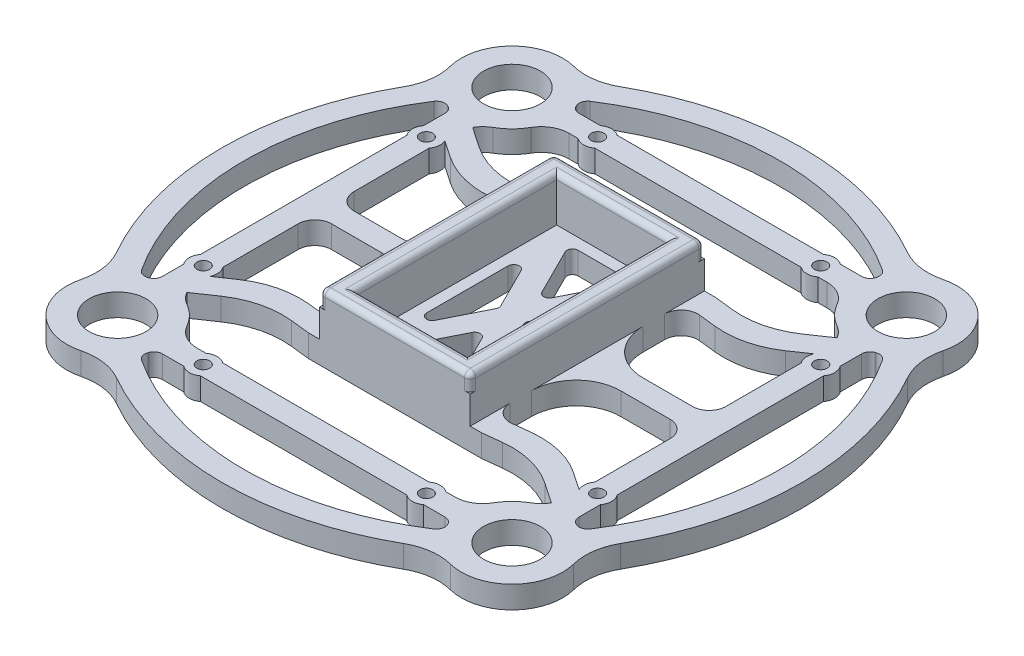
from build123d import *

# Parameters (mm, degrees)
SKETCH1_R           = 5.1
BOSS_EXTRUDE1_DEPTH = 4
BOSS_EXTRUDE2_START = -4
BOSS_EXTRUDE2_DEPTH = 4
SKETCH3_R           = 2.5
BOSS_EXTRUDE3_DEPTH = 4
SKETCH4_R           = 1.15
CUT_EXTRUDE1_DEPTH  = 4
FILLET1_R           = 10
FILLET2_R           = 1.5
FILLET3_R           = 5
BOSS_EXTRUDE4_START = -4
SKETCH5_W           = 31
SKETCH5_H           = 42
SKETCH5_W_2         = 17.855339059
SKETCH5_H_2         = 3
BOSS_EXTRUDE4_DEPTH = 4
SKETCH6_W           = 27
SKETCH6_H           = 42
SKETCH6_W_2         = 20
SKETCH6_H_2         = 36
BOSS_EXTRUDE5_DEPTH = 8
CUT_EXTRUDE4_DEPTH  = 74.972968176
FILLET4_R           = 15
FILLET5_R           = 8
FILLET6_R           = 3
FILLET9_START       = 9
FILLET9_DEPTH       = 4
FILLET10_START      = 9
FILLET10_DEPTH      = 4
FILLET11_START      = 9
FILLET11_DEPTH      = 4
FILLET12_START      = 9
FILLET12_DEPTH      = 4
FILLET13_R          = 1
CUT_EXTRUDE5_DEPTH  = 74.972968176
FILLET14_R          = 1
SKETCH10_R          = 1.5
CUT_EXTRUDE6_DEPTH  = 3


with BuildPart() as part:
    # Sketch1 → Boss-Extrude1 (new body)
    with BuildSketch(Plane(origin=(0, 0, 0), x_dir=(1, 0, 0), z_dir=(0, 1, 0))):
        with BuildLine():
            ThreePointArc((-42.589636172, 29.834927363), (-52, 0), (-42.589636172, -29.834927363))
            ThreePointArc((-42.589636172, -29.834927363), (-41.790010768, -41.790010768), (-29.834927363, -42.589636172))
            ThreePointArc((-29.834927363, -42.589636172), (0, -52), (29.834927363, -42.589636172))
            ThreePointArc((29.834927363, -42.589636172), (41.790010768, -41.790010768), (42.589636172, -29.834927363))
            ThreePointArc((42.589636172, -29.834927363), (52, 0), (42.589636172, 29.834927363))
            ThreePointArc((42.589636172, 29.834927363), (41.790010768, 41.790010768), (29.834927363, 42.589636172))
            ThreePointArc((29.834927363, 42.589636172), (0, 52), (-29.834927363, 42.589636172))
            ThreePointArc((-29.834927363, 42.589636172), (-41.790010768, 41.790010768), (-42.589636172, 29.834927363))
        make_face()
        with Locations(Location((-35.355339059, -35.355339059, 0), (0, 0, 270))):
            Circle(SKETCH1_R, mode=Mode.SUBTRACT)
        with Locations(Location((35.355339059, -35.355339059, 0), (0, 0, 270))):
            Circle(SKETCH1_R, mode=Mode.SUBTRACT)
        with BuildLine():
            ThreePointArc((-27.258640426, -39.509068859), (-28.920667351, -28.920667351), (-39.509068859, -27.258640426))
            ThreePointArc((-39.509068859, -27.258640426), (-48, 0), (-39.509068859, 27.258640426))
            ThreePointArc((-39.509068859, 27.258640426), (-28.920667351, 28.920667351), (-27.258640426, 39.509068859))
            ThreePointArc((-27.258640426, 39.509068859), (0, 48), (27.258640426, 39.509068859))
            ThreePointArc((27.258640426, 39.509068859), (28.920667351, 28.920667351), (39.509068859, 27.258640426))
            ThreePointArc((39.509068859, 27.258640426), (48, 0), (39.509068859, -27.258640426))
            ThreePointArc((39.509068859, -27.258640426), (28.920667351, -28.920667351), (27.258640426, -39.509068859))
            ThreePointArc((27.258640426, -39.509068859), (0, -48), (-27.258640426, -39.509068859))
        make_face(mode=Mode.SUBTRACT)
        with Locations(Location((-35.355339059, 35.355339059, 0), (0, 0, 270))):
            Circle(SKETCH1_R, mode=Mode.SUBTRACT)
        with Locations(Location((35.355339059, 35.355339059, 0), (0, 0, 270))):
            Circle(SKETCH1_R, mode=Mode.SUBTRACT)
    extrude(amount=BOSS_EXTRUDE1_DEPTH)

    # Sketch2 → Boss-Extrude2 (add)
    with BuildSketch(Plane(origin=(0, 4, 0), x_dir=(1, 0, 0), z_dir=(0, 1, 0)).offset(BOSS_EXTRUDE2_START)):
        with BuildLine():
            ThreePointArc((-26.255339059, 35.355339059), (-26.311135203, 34.349169788), (-26.477839411, 33.355339059))
            Line((-26.477839411, 33.355339059), (26.477839411, 33.355339059))
            ThreePointArc((26.477839411, 33.355339059), (26.255339059, 35.355339059), (26.477839411, 37.355339059))
            Line((26.477839411, 37.355339059), (-26.477839411, 37.355339059))
            ThreePointArc((-26.477839411, 37.355339059), (-26.311135203, 36.36150833), (-26.255339059, 35.355339059))
        make_face()
        with BuildLine():
            Line((-33.355339059, -26.477839411), (-33.355339059, 26.477839411))
            ThreePointArc((-33.355339059, 26.477839411), (-35.355339059, 26.255339059), (-37.355339059, 26.477839411))
            Line((-37.355339059, 26.477839411), (-37.355339059, -26.477839411))
            ThreePointArc((-37.355339059, -26.477839411), (-35.355339059, -26.255339059), (-33.355339059, -26.477839411))
        make_face()
        with BuildLine():
            ThreePointArc((37.355339059, 26.477839411), (35.355339059, 26.255339059), (33.355339059, 26.477839411))
            Line((33.355339059, 26.477839411), (33.355339059, -26.477839411))
            ThreePointArc((33.355339059, -26.477839411), (35.355339059, -26.255339059), (37.355339059, -26.477839411))
            Line((37.355339059, -26.477839411), (37.355339059, 26.477839411))
        make_face()
        with BuildLine():
            Line((26.477839411, -33.355339059), (-26.477839411, -33.355339059))
            ThreePointArc((-26.477839411, -33.355339059), (-26.311135203, -34.349169788), (-26.255339059, -35.355339059))
            ThreePointArc((-26.255339059, -35.355339059), (-26.311135203, -36.36150833), (-26.477839411, -37.355339059))
            Line((-26.477839411, -37.355339059), (26.477839411, -37.355339059))
            ThreePointArc((26.477839411, -37.355339059), (26.255339059, -35.355339059), (26.477839411, -33.355339059))
        make_face()
    extrude(amount=BOSS_EXTRUDE2_DEPTH)

    # Sketch3 → Boss-Extrude3 (add)
    with BuildSketch(Plane(origin=(0, 4, 0), x_dir=(1, 0, 0), z_dir=(0, 1, 0))):
        with Locations((-20, 35.355339059)):
            Circle(SKETCH3_R)
        with Locations((20, 35.355339059)):
            Circle(SKETCH3_R)
        with Locations((35.355339059, 20)):
            Circle(SKETCH3_R)
        with Locations((35.355339059, -20)):
            Circle(SKETCH3_R)
        with Locations((-35.355339059, -20)):
            Circle(SKETCH3_R)
        with Locations((-35.355339059, 20)):
            Circle(SKETCH3_R)
        with Locations((-20, -35.355339059)):
            Circle(SKETCH3_R)
        with Locations((20, -35.355339059)):
            Circle(SKETCH3_R)
    extrude(amount=-BOSS_EXTRUDE3_DEPTH)

    # Sketch4 → Cut-Extrude1 (cut)
    with BuildSketch(Plane(origin=(0, 4, 0), x_dir=(1, 0, 0), z_dir=(0, 1, 0))):
        with Locations(Location((-20, 35.355339059, 0), (0, 0, 270))):
            Circle(SKETCH4_R)
        with Locations(Location((20, 35.355339059, 0), (0, 0, 270))):
            Circle(SKETCH4_R)
        with Locations(Location((-35.355339059, 20, 0), (0, 0, 270))):
            Circle(SKETCH4_R)
        with Locations(Location((-35.355339059, -20, 0), (0, 0, 270))):
            Circle(SKETCH4_R)
        with Locations(Location((-20, -35.355339059, 0), (0, 0, 270))):
            Circle(SKETCH4_R)
        with Locations(Location((20, -35.355339059, 0), (0, 0, 270))):
            Circle(SKETCH4_R)
        with Locations(Location((35.355339059, -20, 0), (0, 0, 270))):
            Circle(SKETCH4_R)
        with Locations(Location((35.355339059, 20, 0), (0, 0, 270))):
            Circle(SKETCH4_R)
    extrude(amount=-CUT_EXTRUDE1_DEPTH, mode=Mode.SUBTRACT)

    # Fillet1
    fillet1_edges = [part.edges().sort_by_distance(p)[0] for p in [
        (-42.589636172, 2, 29.834927363),
        (-42.589636172, 2, -29.834927363),
        (-29.834927363, 2, -42.589636172),
        (29.834927363, 2, -42.589636172),
        (42.589636172, 2, -29.834927363),
        (42.589636172, 2, 29.834927363),
        (29.834927363, 2, 42.589636172),
        (-29.834927363, 2, 42.589636172),
    ]]
    fillet(fillet1_edges, radius=FILLET1_R)

    # Fillet2
    fillet2_edges = [part.edges().sort_by_distance(p)[0] for p in [
        (37.355339059, 2, -26.477839411),
        (37.355339059, 2, 26.477839411),
        (-26.477839411, 2, 37.355339059),
        (26.477839411, 2, 37.355339059),
        (27.258640426, 2, 39.509068859),
        (39.509068859, 2, 27.258640426),
        (39.509068859, 2, -27.258640426),
        (27.258640426, 2, -39.509068859),
        (-27.258640426, 2, -39.509068859),
        (-39.509068859, 2, -27.258640426),
        (-39.509068859, 2, 27.258640426),
        (-27.258640426, 2, 39.509068859),
        (-26.477839411, 2, -37.355339059),
        (26.477839411, 2, -37.355339059),
        (-37.355339059, 2, -26.477839411),
        (-37.355339059, 2, 26.477839411),
    ]]
    fillet(fillet2_edges, radius=FILLET2_R)

    # Fillet3
    fillet3_edges = [part.edges().sort_by_distance(p)[0] for p in [
        (33.355339059, 2, -26.477839411),
        (33.355339059, 2, 26.477839411),
        (-26.477839411, 2, 33.355339059),
        (26.477839411, 2, 33.355339059),
        (-26.477839411, 2, -33.355339059),
        (26.477839411, 2, -33.355339059),
        (-33.355339059, 2, -26.477839411),
        (-33.355339059, 2, 26.477839411),
    ]]
    fillet(fillet3_edges, radius=FILLET3_R)

    # Sketch5 → Boss-Extrude4 (add)
    with BuildSketch(Plane.XZ.offset(BOSS_EXTRUDE4_START)):
        with BuildLine():
            Line((-15.5, -21), (-15.5, -1.5))
            Line((-15.5, -1.5), (-33.355339059, -1.5))
            Line((-33.355339059, -1.5), (-33.355339059, -23.115649521))
            ThreePointArc((-33.355339059, -23.115649521), (-33.183642498, -24.414682202), (-32.680344696, -25.624499106))
            Line((-32.680344696, -25.624499106), (-24.43, -20))
            Line((-24.43, -20), (-15.5, -21))
        make_face()
        with BuildLine():
            Line((-15.5, 1.5), (-15.5, 21))
            Line((-15.5, 21), (-24.43, 20))
            Line((-24.43, 20), (-32.680344696, 25.624499106))
            ThreePointArc((-32.680344696, 25.624499106), (-33.183642498, 24.414682202), (-33.355339059, 23.115649521))
            Line((-33.355339059, 23.115649521), (-33.355339059, 1.5))
            Line((-33.355339059, 1.5), (-15.5, 1.5))
        make_face()
        Rectangle(SKETCH5_W, SKETCH5_H)
        with BuildLine():
            Line((33.355339059, -23.115649521), (33.355339059, -1.5))
            Line((33.355339059, -1.5), (15.5, -1.5))
            Line((15.5, -1.5), (15.5, -21))
            Line((15.5, -21), (24.43, -20))
            Line((24.43, -20), (32.680344696, -25.624499106))
            ThreePointArc((32.680344696, -25.624499106), (33.183642498, -24.414682202), (33.355339059, -23.115649521))
        make_face()
        with BuildLine():
            ThreePointArc((33.355339059, 23.115649521), (33.183642498, 24.414682202), (32.680344696, 25.624499106))
            Line((32.680344696, 25.624499106), (24.43, 20))
            Line((24.43, 20), (15.5, 21))
            Line((15.5, 21), (15.5, 1.5))
            Line((15.5, 1.5), (33.355339059, 1.5))
            Line((33.355339059, 1.5), (33.355339059, 23.115649521))
        make_face()
        with Locations((24.42766953, 0)):
            Rectangle(SKETCH5_W_2, SKETCH5_H_2)
        with Locations((-24.42766953, 0)):
            Rectangle(SKETCH5_W_2, SKETCH5_H_2)
    extrude(amount=BOSS_EXTRUDE4_DEPTH)

    # Sketch6 → Boss-Extrude5 (add)
    with BuildSketch(Plane(origin=(0, 4, 0), x_dir=(1, 0, 0), z_dir=(0, 1, 0))):
        Rectangle(SKETCH6_W, SKETCH6_H)
        Rectangle(SKETCH6_W_2, SKETCH6_H_2, mode=Mode.SUBTRACT)
    extrude(amount=BOSS_EXTRUDE5_DEPTH)

    # Sketch9 → Cut-Extrude4 (cut, through all)
    with BuildSketch(Plane(origin=(0, 4, 0), x_dir=(1, 0, 0), z_dir=(0, 1, 0))):
        with BuildLine():
            Line((-13.5, 2), (-13.5, 17.198962328))
            Line((-13.5, 17.198962328), (-25.458182346, 15.859860162))
            Line((-25.458182346, 15.859860162), (-33.093599639, 21.065145434))
            ThreePointArc((-33.093599639, 21.065145434), (-32.915631234, 20.545734116), (-32.855339059, 20))
            ThreePointArc((-32.855339059, 20), (-32.983630814, 19.209430585), (-33.355339059, 18.5))
            Line((-33.355339059, 18.5), (-33.355339059, 2))
            Line((-33.355339059, 2), (-13.5, 2))
        make_face()
        with BuildLine():
            Line((-13.5, -17.198962328), (-13.5, -2))
            Line((-13.5, -2), (-33.355339059, -2))
            Line((-33.355339059, -2), (-33.355339059, -18.5))
            ThreePointArc((-33.355339059, -18.5), (-32.983630814, -19.209430585), (-32.855339059, -20))
            ThreePointArc((-32.855339059, -20), (-32.915631234, -20.545734116), (-33.093599639, -21.065145434))
            Line((-33.093599639, -21.065145434), (-25.458182346, -15.859860162))
            Line((-25.458182346, -15.859860162), (-13.5, -17.198962328))
        make_face()
        with BuildLine():
            Line((25.458182346, 15.859860162), (13.5, 17.198962328))
            Line((13.5, 17.198962328), (13.5, 2))
            Line((13.5, 2), (33.355339059, 2))
            Line((33.355339059, 2), (33.355339059, 18.5))
            ThreePointArc((33.355339059, 18.5), (32.868252713, 19.746225485), (33.093599639, 21.065145434))
            Line((33.093599639, 21.065145434), (25.458182346, 15.859860162))
        make_face()
        with BuildLine():
            Line((33.355339059, -2), (13.5, -2))
            Line((13.5, -2), (13.5, -17.198962328))
            Line((13.5, -17.198962328), (25.458182346, -15.859860162))
            Line((25.458182346, -15.859860162), (33.093599639, -21.065145434))
            ThreePointArc((33.093599639, -21.065145434), (32.868252713, -19.746225485), (33.355339059, -18.5))
            Line((33.355339059, -18.5), (33.355339059, -2))
        make_face()
    extrude(amount=-CUT_EXTRUDE4_DEPTH, mode=Mode.SUBTRACT)

    # Fillet4
    fillet4_edges = [part.edges().sort_by_distance(p)[0] for p in [
        (24.43, 2, -20),
        (-24.43, 2, -20),
        (-24.43, 2, 20),
        (24.43, 2, 20),
        (-25.458182346, 2, 15.859860162),
        (25.458182346, 2, -15.859860162),
        (25.458182346, 2, 15.859860162),
        (-25.458182346, 2, -15.859860162),
    ]]
    fillet(fillet4_edges, radius=FILLET4_R)

    # Fillet5
    fillet5_edges = [part.edges().sort_by_distance(p)[0] for p in [
        (-13.5, 2, 2),
        (13.5, 2, -2),
        (13.5, 2, 2),
        (-13.5, 2, -2),
    ]]
    fillet(fillet5_edges, radius=FILLET5_R)

    # Fillet6
    fillet6_edges = [part.edges().sort_by_distance(p)[0] for p in [
        (-33.355339059, 2, 2),
        (-13.5, 2, 17.198962328),
        (33.355339059, 2, -2),
        (13.5, 2, -17.198962328),
        (13.5, 2, 17.198962328),
        (33.355339059, 2, 2),
        (-13.5, 2, -17.198962328),
        (-33.355339059, 2, -2),
    ]]
    fillet(fillet6_edges, radius=FILLET6_R)

    # Fillet9: read off the stored shape, not the designer's step
    # Fillet9 outline → Fillet9 (cut)
    with BuildSketch(Plane(origin=(0, 0, 0), x_dir=(1, 0, 0), z_dir=(0, 1, 0)).offset(FILLET9_START)):
        with BuildLine():
            ThreePointArc((-13.5, 20), (-13.207106781, 20.707106781), (-12.5, 21))
            Line((-12.5, 21), (-13.5, 21))
            Line((-13.5, 21), (-13.5, 20))
        make_face()
    extrude(amount=FILLET9_DEPTH, mode=Mode.SUBTRACT)

    # Fillet10: read off the stored shape, not the designer's step
    # Fillet10 outline → Fillet10 (cut)
    with BuildSketch(Plane(origin=(0, 0, 0), x_dir=(1, 0, 0), z_dir=(0, 1, 0)).offset(FILLET10_START)):
        with BuildLine():
            Line((-13.5, -21), (-12.5, -21))
            ThreePointArc((-12.5, -21), (-13.207106781, -20.707106781), (-13.5, -20))
            Line((-13.5, -20), (-13.5, -21))
        make_face()
    extrude(amount=FILLET10_DEPTH, mode=Mode.SUBTRACT)

    # Fillet11: read off the stored shape, not the designer's step
    # Fillet11 outline → Fillet11 (cut)
    with BuildSketch(Plane(origin=(0, 0, 0), x_dir=(1, 0, 0), z_dir=(0, 1, 0)).offset(FILLET11_START)):
        with BuildLine():
            Line((13.5, -21), (13.5, -20))
            ThreePointArc((13.5, -20), (13.207106781, -20.707106781), (12.5, -21))
            Line((12.5, -21), (13.5, -21))
        make_face()
    extrude(amount=FILLET11_DEPTH, mode=Mode.SUBTRACT)

    # Fillet12: read off the stored shape, not the designer's step
    # Fillet12 outline → Fillet12 (cut)
    with BuildSketch(Plane(origin=(0, 0, 0), x_dir=(1, 0, 0), z_dir=(0, 1, 0)).offset(FILLET12_START)):
        with BuildLine():
            ThreePointArc((12.5, 21), (13.207106781, 20.707106781), (13.5, 20))
            Line((13.5, 20), (13.5, 21))
            Line((13.5, 21), (12.5, 21))
        make_face()
    extrude(amount=FILLET12_DEPTH, mode=Mode.SUBTRACT)

    # Fillet13
    fillet13_edges = [part.edges().sort_by_distance(p)[0] for p in [
        (10, 12, 0),
        (0, 12, -18),
        (-10, 12, 0),
        (0, 12, 18),
        (-13.5, 12, 0),
        (-13.207106781, 12, -20.707106781),
        (0, 12, 21),
        (-13.207106781, 12, 20.707106781),
        (13.5, 12, 0),
        (13.207106781, 12, 20.707106781),
        (0, 12, -21),
        (13.207106781, 12, -20.707106781),
    ]]
    fillet(fillet13_edges, radius=FILLET13_R)

    # Sketch7 → Cut-Extrude5 (cut, through all)
    with BuildSketch(Plane(origin=(0, 4, 0), x_dir=(1, 0, 0), z_dir=(0, 1, 0))):
        Polygon((-8, 11.527864045), (-8, -11.527864045), (-2.236067977, 0), align=None)
        Polygon((-5.763932023, 16), (0, 4.472135955), (5.763932023, 16), align=None)
        Polygon((8, 11.527864045), (2.236067977, 0), (8, -11.527864045), align=None)
        Polygon((0, -4.472135955), (-5.763932023, -16), (5.763932023, -16), align=None)
    extrude(amount=-CUT_EXTRUDE5_DEPTH, mode=Mode.SUBTRACT)

    # Fillet14
    fillet14_edges = [part.edges().sort_by_distance(p)[0] for p in [
        (8, 2, -11.527864045),
        (8, 2, 11.527864045),
        (2.236067977, 2, 0),
        (5.763932023, 2, -16),
        (0, 2, -4.472135955),
        (-5.763932023, 2, -16),
        (0, 2, 4.472135955),
        (5.763932023, 2, 16),
        (-5.763932023, 2, 16),
        (-2.236067977, 2, 0),
        (-8, 2, 11.527864045),
        (-8, 2, -11.527864045),
    ]]
    fillet(fillet14_edges, radius=FILLET14_R)

    # Sketch10 → Cut-Extrude6 (cut)
    with BuildSketch(Plane.XZ):
        with Locations(Location((-8.89, 10.135, 0), (0, 0, 270))):
            Circle(SKETCH10_R)
        with Locations(Location((8.89, 10.135, 0), (0, 0, 270))):
            Circle(SKETCH10_R)
        with Locations(Location((8.89, -10.135, 0), (0, 0, 270))):
            Circle(SKETCH10_R)
        with Locations(Location((-8.89, -10.135, 0), (0, 0, 270))):
            Circle(SKETCH10_R)
    extrude(amount=-CUT_EXTRUDE6_DEPTH, mode=Mode.SUBTRACT)


solid = part.part
